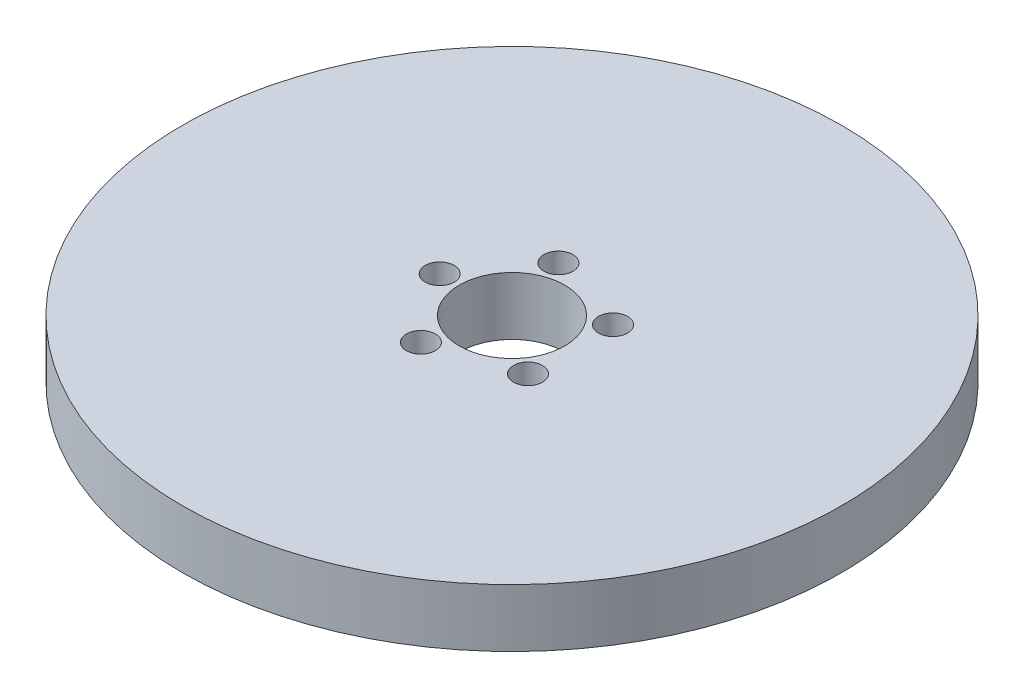
from build123d import *

# Parameters (mm, degrees)
SKETCH1_R           = 62.5
BOSS_EXTRUDE1_DEPTH = 11
SKETCH2_R           = 10
CUT_EXTRUDE1_DEPTH  = 90.070197036
SKETCH3_R           = 2.751238441
CUT_EXTRUDE2_DEPTH  = 10.722088982
CIRPATTERN1_COUNT   = 5


with BuildPart() as part:
    # Sketch1 → Boss-Extrude1 (new body)
    with BuildSketch(Plane(origin=(0, 0, 0), x_dir=(1, 0, 0), z_dir=(0, 1, 0))):
        Circle(SKETCH1_R)
    extrude(amount=BOSS_EXTRUDE1_DEPTH)

    # Sketch2 → Cut-Extrude1 (cut, through all)
    with BuildSketch(Plane(origin=(0, 0, 0), x_dir=(1, 0, 0), z_dir=(0, 1, 0))):
        Circle(SKETCH2_R)
    extrude(amount=CUT_EXTRUDE1_DEPTH, mode=Mode.SUBTRACT)

    # Sketch3 → Cut-Extrude2 (cut)
    with BuildSketch(Plane(origin=(0, 11, 0), x_dir=(1, 0, 0), z_dir=(0, 1, 0))):
        with Locations((-13.710736915, 0)):
            Circle(SKETCH3_R)
    cut_extrude2 = extrude(amount=-CUT_EXTRUDE2_DEPTH, mode=Mode.SUBTRACT)

    # CirPattern1: Cut-Extrude2 ×5 about axis
    cirpattern1_axis = Axis((0, 0, 0), (0, 1, 0))
    for i in range(1, CIRPATTERN1_COUNT):
        add(cut_extrude2.rotate(cirpattern1_axis, i * 360 / CIRPATTERN1_COUNT), mode=Mode.SUBTRACT)


solid = part.part
